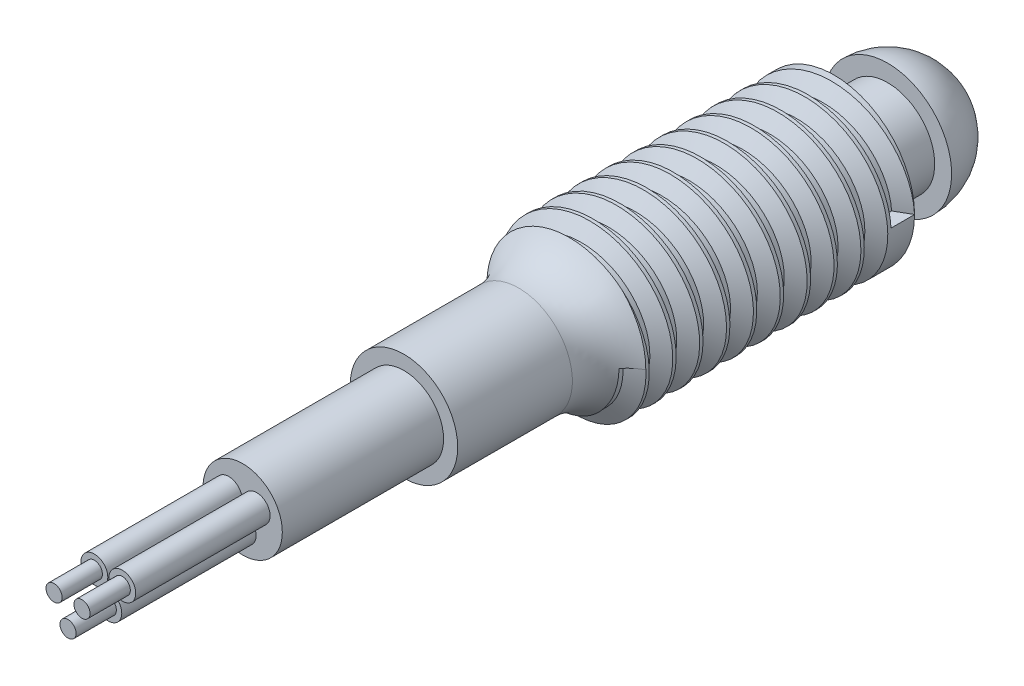
from build123d import *

# Parameters (mm, degrees)
REVOLVE2_ANGLE      = 180
SKETCH3_R           = 1.75
BOSS_EXTRUDE1_DEPTH = 2
SKETCH4_R           = 3
BOSS_EXTRUDE2_DEPTH = 10
SKETCH5_R           = 2
BOSS_EXTRUDE3_DEPTH = 6
FILLET1_R           = 2
SKETCH6_R           = 1.474518503
BOSS_EXTRUDE4_DEPTH = 6
SKETCH7_R           = 0.5
BOSS_EXTRUDE5_DEPTH = 5
SKETCH8_R           = 0.3
BOSS_EXTRUDE6_DEPTH = 1.5
THREAD1_PITCH       = 1


with BuildPart() as part:
    # Sketch2 → Revolve2 (revolve)
    with BuildSketch(Plane.XY):
        with BuildLine():
            Line((0, 2.38), (0, -2.38))
            ThreePointArc((0, -2.38), (-2.38, 0), (0, 2.38))
        make_face()
    revolve(axis=Axis((0, 3.833035684, 0), (0, -1, 0)), revolution_arc=REVOLVE2_ANGLE)

    # Sketch3 → Boss-Extrude1 (add)
    with BuildSketch(Plane.XY):
        with Locations(Location((0, 0, 0), (0, 0, 180))):
            Circle(SKETCH3_R)
    extrude(amount=BOSS_EXTRUDE1_DEPTH)

    # Sketch4 → Boss-Extrude2 (add)
    with BuildSketch(Plane.XY.offset(2)):
        Circle(SKETCH4_R)
    extrude(amount=BOSS_EXTRUDE2_DEPTH)

    # Sketch5 → Boss-Extrude3 (add)
    with BuildSketch(Plane.XY.offset(12)):
        Circle(SKETCH5_R)
    extrude(amount=BOSS_EXTRUDE3_DEPTH)

    # Fillet1
    # the kernel refuses this fillet: 2 mm, written as the material it adds along each edge
    with BuildSketch(Plane(origin=(0, 0, 12), x_dir=(1, 0, 0), z_dir=(0, -1, 0))) as fillet1_piece_1:
        with BuildLine():
            CenterArc((4, 1.732050808), FILLET1_R, 180, 60)
            Line((2, 1.732050808), (1.96, 1.732050808))
            Line((1.96, 1.732050808), (1.96, 0))
            Line((1.96, 0), (2, -0.04))
            ThreePointArc((2, -0.04), (2.5, -0.04), (2.98, -0.034641016))
            Line((2.98, -0.034641016), (3, 0))
        make_face()
    revolve(axis=Axis((0, 0, 12), (0, 0, 1)))

    # Sketch6 → Boss-Extrude4 (add)
    with BuildSketch(Plane.XY.offset(18)):
        Circle(SKETCH6_R)
    extrude(amount=BOSS_EXTRUDE4_DEPTH)

    # Sketch7 → Boss-Extrude5 (add)
    with BuildSketch(Plane.XY.offset(24)):
        with Locations((-0.519615242, 0.3)):
            Circle(SKETCH7_R)
        with Locations((0.519615242, 0.3)):
            Circle(SKETCH7_R)
        with Locations((0, -0.6)):
            Circle(SKETCH7_R)
    extrude(amount=BOSS_EXTRUDE5_DEPTH)

    # Sketch8 → Boss-Extrude6 (add)
    with BuildSketch(Plane.XY.offset(29)):
        with Locations((-0.519615242, 0.3)):
            Circle(SKETCH8_R)
        with Locations((0.519615242, 0.3)):
            Circle(SKETCH8_R)
        with Locations((0, -0.6)):
            Circle(SKETCH8_R)
    extrude(amount=BOSS_EXTRUDE6_DEPTH)

    # Thread1: the profile of Thread Profile1 profile screwed along a right-hand helix of 10 turns, 8 arcs to a turn; built about Z, then put on its axis
    thread1_z = Axis((0, 0, 0), (0, 0, 1))
    thread1_corners = [(3.0003, 0, -0.000173205), (3.0003, 0, 0.875173202), (2.458734125, 0, 0.562499999), (2.458734125, 0, 0.312499999)]
    with BuildLine(mode=Mode.PRIVATE) as thread1_profile:
        Line(thread1_corners[0], thread1_corners[1])
        Line(thread1_corners[1], thread1_corners[2])
        Line(thread1_corners[2], thread1_corners[3])
        Line(thread1_corners[3], thread1_corners[0])
    thread1_cap = Face(thread1_profile.wire())
    thread1_turn_angles = [0, 22.5, 45, 67.5, 90, 112.5, 135, 157.5, 180, 202.5, 225, 247.5, 270, 292.5, 315, 337.5, 360]
    thread1_turn_weights = [1, 0.9238795325112867, 1, 0.9238795325112867, 1, 0.9238795325112867, 1, 0.9238795325112867, 1, 0.9238795325112867, 1, 0.9238795325112867, 1, 0.9238795325112867, 1, 0.9238795325112867, 1]
    thread1_turn_rails = [Edge.make_bspline([Vector(p[0], p[1], 0).rotate(thread1_z, thread1_turn_angles[k]) / thread1_turn_weights[k] + Vector(0, 0, p[2] + THREAD1_PITCH * thread1_turn_angles[k] / 360) for k in range(17)], [0, 0, 0, 1, 1, 2, 2, 3, 3, 4, 4, 5, 5, 6, 6, 7, 7, 8, 8, 8], 2, thread1_turn_weights) for p in thread1_corners]
    thread1_turn_sides = [Face.make_surface_from_curves(thread1_turn_rails[p[0]], thread1_turn_rails[p[1]]) for p in [(0, 1), (1, 2), (2, 3), (3, 0)]]
    thread1 = Plane(origin=(0, 0, 2), x_dir=(1, 0, 0), z_dir=(0, 0, 1)) * Solid(Shell([*[p.moved(Location((0, 0, THREAD1_PITCH * i))) for i in range(10) for p in thread1_turn_sides], thread1_cap, thread1_cap.rotate(thread1_z, 3600).moved(Location((0, 0, THREAD1_PITCH * 3600 / 360)))]))
    add(thread1, mode=Mode.SUBTRACT)


solid = part.part
